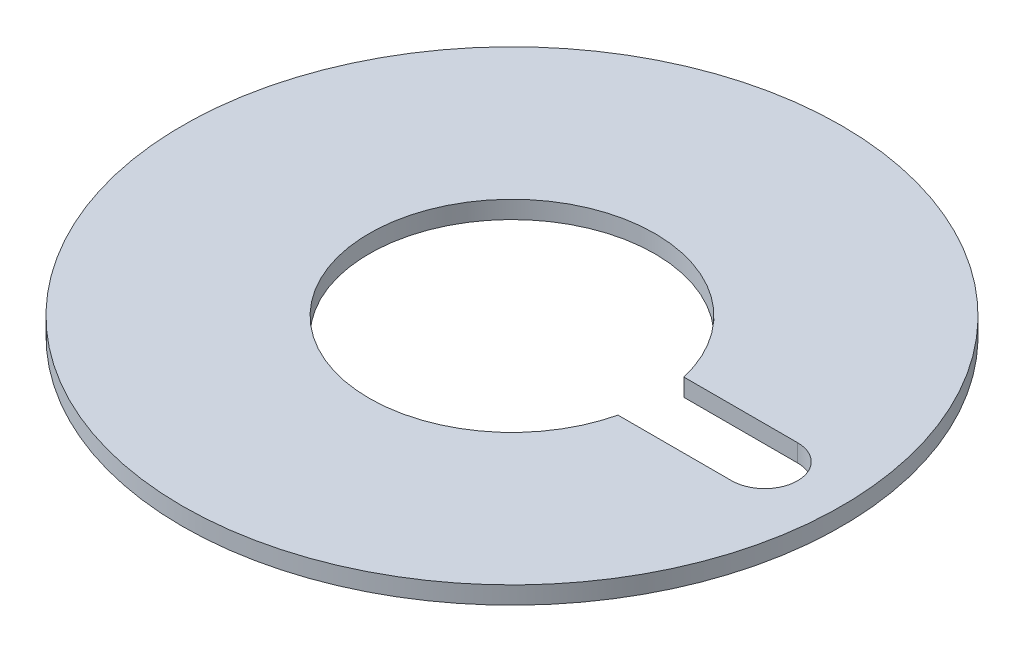
from build123d import *

# Parameters (mm, degrees)
SKETCH1_R           = 15
BOSS_EXTRUDE1_DEPTH = 0.8
CUT_EXTRUDE1_DEPTH  = 22.228283021


with BuildPart() as part:
    # Sketch1 → Boss-Extrude1 (new body)
    with BuildSketch(Plane(origin=(0, 0, 0), x_dir=(1, 0, 0), z_dir=(0, 1, 0))):
        Circle(SKETCH1_R)
    extrude(amount=BOSS_EXTRUDE1_DEPTH)

    # Sketch3 → Cut-Extrude1 (cut, through all)
    with BuildSketch(Plane(origin=(0, 0.8, 0), x_dir=(1, 0, 0), z_dir=(0, 1, 0))):
        with BuildLine():
            Line((6.32455532, -1.5), (11.5, -1.5))
            ThreePointArc((11.5, -1.5), (13, 0), (11.5, 1.5))
            Line((11.5, 1.5), (6.32455532, 1.5))
            ThreePointArc((6.32455532, 1.5), (-6.5, 0), (6.32455532, -1.5))
        make_face()
    extrude(amount=-CUT_EXTRUDE1_DEPTH, mode=Mode.SUBTRACT)


solid = part.part
